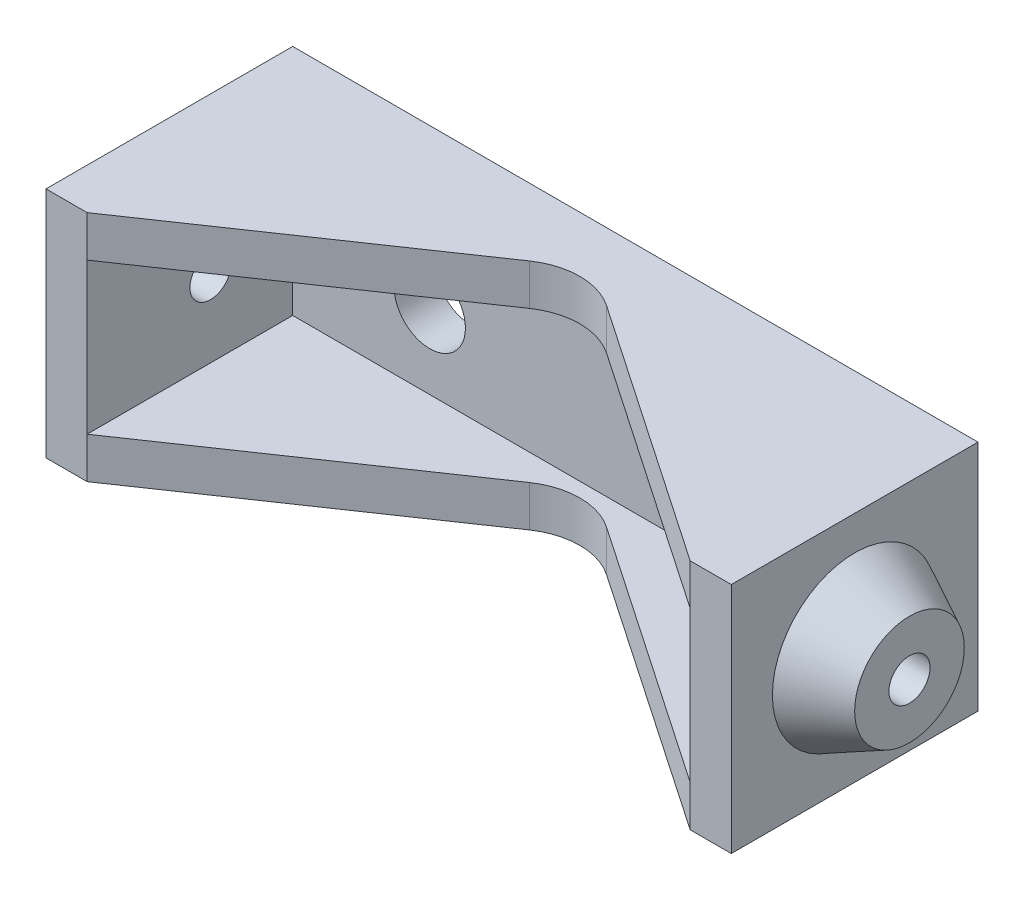
from build123d import *
from OCP.BRepFilletAPI import BRepFilletAPI_MakeChamfer

# Parameters (mm, degrees)
SKETCH_1_W               = 50
SKETCH_1_H               = 17
EXTRUDE_1_DEPTH          = 18
SKETCH_2_W               = 44
SKETCH_2_H               = 11
CUT_EXTRUDE_1_DEPTH      = 15
CUT_EXTRUDE_2_DEPTH      = 36.185224172
CUT_EXTRUDE_2_DEPTH_BACK = 17
SKETCH_4_R               = 2.6
CUT_EXTRUDE_4_DEPTH      = 3
SKETCH_5_R               = 4
SKETCH_5_R_2             = 1.5
EXTRUDE_2_DEPTH          = 4
EXTRUDE_START            = 4
SKETCH_6_R               = 4
SKETCH_6_R_2             = 1.5
EXTRUDE_3_DEPTH          = 4
CHAMFER_1_SIZE           = 2
CHAMFER_1_SIZE_2         = 4
CUT_EXTRUDE_START        = -50
SKETCH_7_R               = 1.5
CUT_EXTRUDE_5_DEPTH      = 50


with BuildPart() as part:
    # 草图1 → 凸台-拉伸1 (new body)
    with BuildSketch(Plane.XY):
        Rectangle(SKETCH_1_W, SKETCH_1_H)
    extrude(amount=EXTRUDE_1_DEPTH)

    # 草图2 → 切除-拉伸1 (cut)
    with BuildSketch(Plane.XY.offset(18)):
        Rectangle(SKETCH_2_W, SKETCH_2_H)
    extrude(amount=-CUT_EXTRUDE_1_DEPTH, mode=Mode.SUBTRACT)

    # 草图3 → 切除-拉伸2 (cut, two sides: drawn at the far end of the back side and taken through both)
    with BuildSketch(Plane(origin=(0, 8.5, 0), x_dir=(1, 0, 0), z_dir=(0, 1, 0)).offset(-CUT_EXTRUDE_2_DEPTH_BACK)):
        with BuildLine():
            Line((-113.428530012, -80.337634099), (-22, -18))
            Line((-22, -18), (-2.816684123, -4.920466448))
            ThreePointArc((-2.816684123, -4.920466448), (0, -4.051603162), (2.816684123, -4.920466448))
            Line((2.816684123, -4.920466448), (22, -18))
            Line((22, -18), (113.428530012, -80.337634099))
            Line((113.428530012, -80.337634099), (113.428530012, -301.653306613))
            Line((113.428530012, -301.653306613), (-113.428530012, -301.653306613))
            Line((-113.428530012, -301.653306613), (-113.428530012, -80.337634099))
        make_face()
    extrude(amount=CUT_EXTRUDE_2_DEPTH + CUT_EXTRUDE_2_DEPTH_BACK, mode=Mode.SUBTRACT)

    # 草图4 → 切除-拉伸4 (cut)
    with BuildSketch(Plane.XY.offset(3)):
        with Locations((-12, 0)):
            Circle(SKETCH_4_R)
        with Locations(Location((12, 0, 0), (0, 0, 180))):
            Circle(SKETCH_4_R)
    extrude(amount=-CUT_EXTRUDE_4_DEPTH, mode=Mode.SUBTRACT)

    # 草图5 → 凸台-拉伸2 (add)
    with BuildSketch(Plane.ZY.offset(25)):
        with Locations(Location((9, 0, 0), (0, 0, 180))):
            Circle(SKETCH_5_R)
        with Locations((9, 0)):
            Circle(SKETCH_5_R_2, mode=Mode.SUBTRACT)
    extrude(amount=EXTRUDE_2_DEPTH)

    # 草图6 → 凸台-拉伸3 (add)
    with BuildSketch(Plane(origin=(25, 0, 0), x_dir=(0, 0, -1), z_dir=(1, 0, 0)).offset(EXTRUDE_START)):
        with Locations((-9, 0)):
            Circle(SKETCH_6_R)
        with Locations(Location((-9, 0, 0), (0, 0, 180))):
            Circle(SKETCH_6_R_2, mode=Mode.SUBTRACT)
    extrude(amount=-EXTRUDE_3_DEPTH)

    # 倒角1
    chamfer_1_edges_1 = [part.edges().sort_by_distance(p)[0] for p in [
        (-25, 0, 13),
    ]]
    chamfer_1_side_1 = [part.faces().sort_by_distance(p)[0] for p in [
        (-25, 0, 13.04),
    ]]
    chamfer_1_edges_2 = [part.edges().sort_by_distance(p)[0] for p in [
        (25, 0, 13),
    ]]
    chamfer_1_side_2 = [part.faces().sort_by_distance(p)[0] for p in [
        (25, 0, 13.04),
    ]]
    chamfer_1 = BRepFilletAPI_MakeChamfer(part.part.solid().wrapped)
    for e in chamfer_1_edges_1:
        chamfer_1.Add(CHAMFER_1_SIZE - 0.0001, CHAMFER_1_SIZE_2 - 0.0001, e.wrapped, chamfer_1_side_1[0].wrapped)
    for e in chamfer_1_edges_2:
        chamfer_1.Add(CHAMFER_1_SIZE - 0.0001, CHAMFER_1_SIZE_2 - 0.0001, e.wrapped, chamfer_1_side_2[0].wrapped)
    add(Compound.cast(chamfer_1.Shape()), mode=Mode.REPLACE)  # a hair under: the kernel refuses the full size

    # 草图7 → 切除-拉伸5 (cut)
    with BuildSketch(Plane.ZY.offset(25).offset(CUT_EXTRUDE_START)):
        with Locations((9, 0)):
            Circle(SKETCH_7_R)
    extrude(amount=CUT_EXTRUDE_5_DEPTH, mode=Mode.SUBTRACT)


solid = part.part
